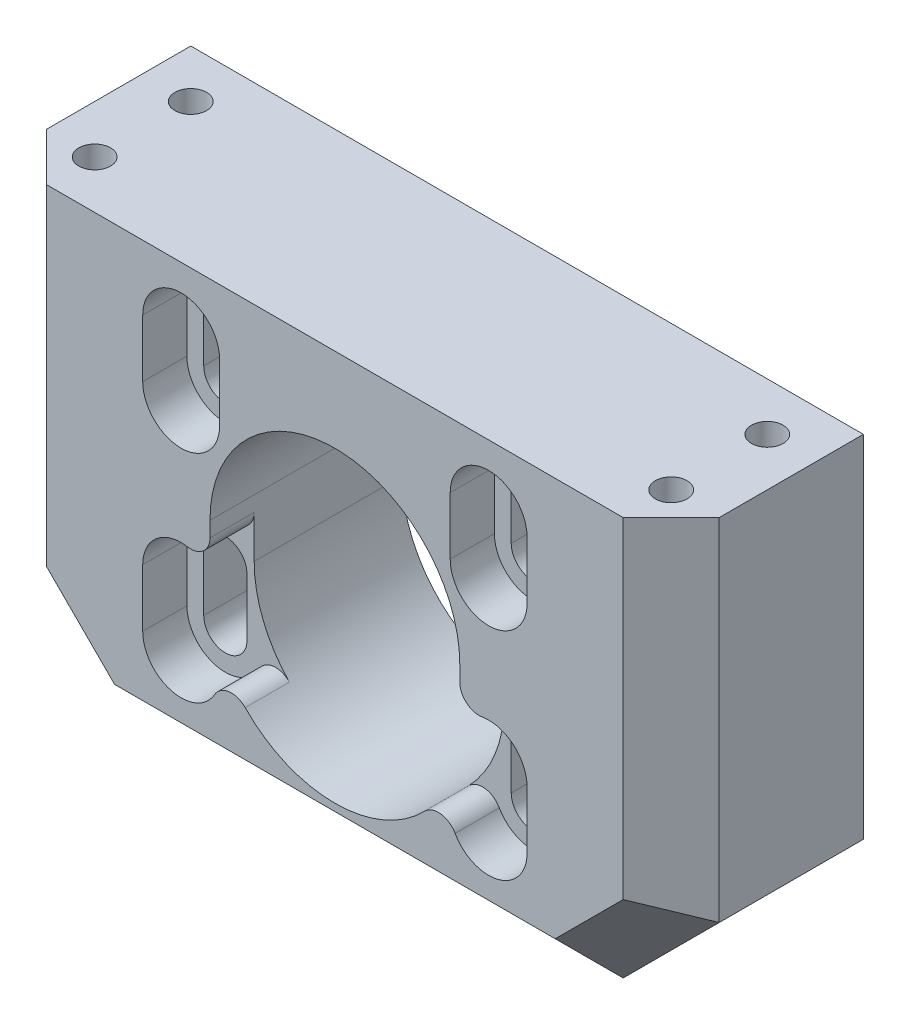
from build123d import *

# Parameters (mm, degrees)
SKETCH1_W                                            = 70
SKETCH1_H                                            = 46.5
BOSS_EXTRUDE1_DEPTH                                  = 20
CUT_EXTRUDE1_DEPTH                                   = 47.535604648
CBORE_FOR_M4_HEXAGON_SOCKET_HEAD_CAP_SCR_D           = 4.5
CBORE_FOR_M4_HEXAGON_SOCKET_HEAD_CAP_SCR_CBORE_D     = 8
CBORE_FOR_M4_HEXAGON_SOCKET_HEAD_CAP_SCR_CBORE_DEPTH = 4.6
CUT_EXTRUDE2_DEPTH                                   = 45.751787674
CUT_EXTRUDE3_DEPTH                                   = 45.751787674
FILLET1_R                                            = 2
CHAMFER1_SIZE                                        = 10
M4_TAPPED_HOLE1_D                                    = 3.3
M4_TAPPED_HOLE1_DEPTH                                = 10
M4_TAPPED_HOLE1_TIP                                  = 0.991420021
CHAMFER2_SIZE                                        = 5


with BuildPart() as part:
    # Sketch1 → Boss-Extrude1 (new body)
    with BuildSketch(Plane.XY):
        Rectangle(SKETCH1_W, SKETCH1_H)
    extrude(amount=BOSS_EXTRUDE1_DEPTH)

    # Sketch2 → Cut-Extrude1 (cut, through all)
    with BuildSketch(Plane.XY.offset(20)):
        with BuildLine():
            Line((-13, -4.5), (-13, 1.5))
            ThreePointArc((-13, 1.5), (0, 14.5), (13, 1.5))
            Line((13, 1.5), (13, -4.5))
            ThreePointArc((13, -4.5), (0, -17.5), (-13, -4.5))
        make_face()
    extrude(amount=-CUT_EXTRUDE1_DEPTH, mode=Mode.SUBTRACT)

    # CBORE for M4 Hexagon socket head cap screws1 (through all)
    with Locations(Plane.XY.offset(20)):
        with Locations((-16, 13.5), (-16, -9), (16, -9), (16, 13.5), (0, -1.5)):
            CounterBoreHole(CBORE_FOR_M4_HEXAGON_SOCKET_HEAD_CAP_SCR_D / 2, CBORE_FOR_M4_HEXAGON_SOCKET_HEAD_CAP_SCR_CBORE_D / 2, CBORE_FOR_M4_HEXAGON_SOCKET_HEAD_CAP_SCR_CBORE_DEPTH)

    # Sketch6 → Cut-Extrude2 (cut, through all)
    with BuildSketch(Plane.XY.offset(15.4)):
        with BuildLine():
            Line((-12, 16.5), (-12, 10.5))
            ThreePointArc((-12, 10.5), (-16, 6.5), (-20, 10.5))
            Line((-20, 10.5), (-20, 16.5))
            ThreePointArc((-20, 16.5), (-16, 20.5), (-12, 16.5))
        make_face()
        with BuildLine():
            Line((-12, -6), (-12, -12))
            ThreePointArc((-12, -12), (-16, -16), (-20, -12))
            Line((-20, -12), (-20, -6))
            ThreePointArc((-20, -6), (-16, -2), (-12, -6))
        make_face()
        with BuildLine():
            Line((20, 16.5), (20, 10.5))
            ThreePointArc((20, 10.5), (16, 6.5), (12, 10.5))
            Line((12, 10.5), (12, 16.5))
            ThreePointArc((12, 16.5), (16, 20.5), (20, 16.5))
        make_face()
        with BuildLine():
            Line((12, -12), (12, -6))
            ThreePointArc((12, -6), (16, -2), (20, -6))
            Line((20, -6), (20, -12))
            ThreePointArc((20, -12), (16, -16), (12, -12))
        make_face()
    extrude(amount=CUT_EXTRUDE2_DEPTH, mode=Mode.SUBTRACT)

    # Sketch7 → Cut-Extrude3 (cut, through all)
    with BuildSketch(Plane.XY.offset(15.4)):
        with BuildLine():
            Line((-13.75, 16.5), (-13.75, 10.5))
            ThreePointArc((-13.75, 10.5), (-16, 8.25), (-18.25, 10.5))
            Line((-18.25, 10.5), (-18.25, 16.5))
            ThreePointArc((-18.25, 16.5), (-16, 18.75), (-13.75, 16.5))
        make_face()
        with BuildLine():
            Line((-18.25, -12), (-18.25, -6))
            ThreePointArc((-18.25, -6), (-16, -3.75), (-13.75, -6))
            Line((-13.75, -6), (-13.75, -12))
            ThreePointArc((-13.75, -12), (-16, -14.25), (-18.25, -12))
        make_face()
        with BuildLine():
            Line((18.25, 16.5), (18.25, 10.5))
            ThreePointArc((18.25, 10.5), (16, 8.25), (13.75, 10.5))
            Line((13.75, 10.5), (13.75, 16.5))
            ThreePointArc((13.75, 16.5), (16, 18.75), (18.25, 16.5))
        make_face()
        with BuildLine():
            Line((18.25, -6), (18.25, -12))
            ThreePointArc((18.25, -12), (16, -14.25), (13.75, -12))
            Line((13.75, -12), (13.75, -6))
            ThreePointArc((13.75, -6), (16, -3.75), (18.25, -6))
        make_face()
    extrude(amount=-CUT_EXTRUDE3_DEPTH, mode=Mode.SUBTRACT)

    # Fillet1
    # the kernel refuses this fillet: 2 mm, written as the material it takes off along each edge
    with BuildSketch(Plane(origin=(13, -3.354248689, 28.17582118), x_dir=(0.8738382268582209, 0.48621677601794083, 0), z_dir=(0, 0, -1))) as fillet1_piece_1:
        with BuildLine():
            CenterArc((3.33776502, -1.885304481), FILLET1_R, 109.498154832, 99.594068227)
            Line((1.590088566, -2.857738033), (0, 0))
            ThreePointArc((0, 0), (1.335106008, -0.229391038), (2.670212016, 0))
        make_face()
    extrude(amount=12.77582118, mode=Mode.SUBTRACT)
    with BuildSketch(Plane(origin=(12, -9.5, 15.4), x_dir=(0.11433437649297556, -0.993442323616204, 0), z_dir=(0, 0, 1))) as fillet1_piece_2:
        with BuildLine():
            CenterArc((5.264320611, -1.843966677), FILLET1_R, 112.782223337, 106.542245194)
            Line((3.717181311, -3.111389253), (3.562467381, -3.238131511))
            ThreePointArc((3.562467381, -3.238131511), (1.876525646, -1.534267667), (-0.097526525, -0.174609785))
            Line((-0.097526525, -0.174609785), (0.022866875, 0.198688465))
            ThreePointArc((0.022866875, 0.198688465), (2.506472684, -0.087147477), (4.412415603, 0.184396668))
            Line((4.412415603, 0.184396668), (4.489861512, 0))
        make_face()
    extrude(amount=16.718730334, mode=Mode.SUBTRACT)
    with BuildSketch(Plane(origin=(-12, -9.5, 15.4), x_dir=(0.549971838681665, -0.8351831994581241, 0), z_dir=(0, 0, 1))) as fillet1_piece_3:
        with BuildLine():
            CenterArc((5.220376144, -1.964931936), FILLET1_R, 100.745216059, 106.542245194)
            Line((3.442940977, -2.881842089), (3.265197461, -2.973533104))
            ThreePointArc((3.265197461, -2.973533104), (1.977963631, -1.541966237), (-0.109994368, -0.16703664))
            Line((-0.109994368, -0.16703664), (0.037288401, 0.196493194))
            ThreePointArc((0.037288401, 0.196493194), (2.423746067, -0.027942413), (4.810203733, 0.196493194))
            Line((4.810203733, 0.196493194), (4.847492134, 0))
        make_face()
    extrude(amount=16.718730334, mode=Mode.SUBTRACT)
    with BuildSketch(Plane(origin=(-13, -3.354248689, 28.17582118), x_dir=(-0.8738382268582207, 0.48621677601794133, 0), z_dir=(0, 0, -1))) as fillet1_piece_4:
        with BuildLine():
            CenterArc((3.33776502, 1.885304481), FILLET1_R, 150.907776941, 99.594068227)
            Line((1.590088566, 2.857738033), (0, 0))
            ThreePointArc((0, 0), (1.335106008, 0.229391038), (2.670212016, 0))
        make_face()
    extrude(amount=12.77582118, mode=Mode.SUBTRACT)

    # Chamfer1
    chamfer1_edges = [part.edges().sort_by_distance(p)[0] for p in [
        (35, -23.25, 10),
        (-35, -23.25, 10),
    ]]
    chamfer(chamfer1_edges, length=CHAMFER1_SIZE)

    # M4 Tapped Hole1
    with Locations(Plane(origin=(0, 23.25, 0), x_dir=(1, 0, 0), z_dir=(0, 1, 0))):
        with Locations((-30, -15), (-30, -5), (30, -5), (30, -15)):
            Hole(M4_TAPPED_HOLE1_D / 2, depth=M4_TAPPED_HOLE1_DEPTH)
            with Locations((0, 0, -(M4_TAPPED_HOLE1_DEPTH + M4_TAPPED_HOLE1_TIP / 2))):  # 118° drill point
                Cone(0, M4_TAPPED_HOLE1_D / 2, M4_TAPPED_HOLE1_TIP, mode=Mode.SUBTRACT)

    # Chamfer2
    chamfer2_edges = [part.edges().sort_by_distance(p)[0] for p in [
        (35, 5, 20),
        (0, -23.25, 20),
        (-30, -18.25, 20),
        (30, -18.25, 20),
        (-35, 5, 20),
    ]]
    chamfer(chamfer2_edges, length=CHAMFER2_SIZE)


solid = part.part
